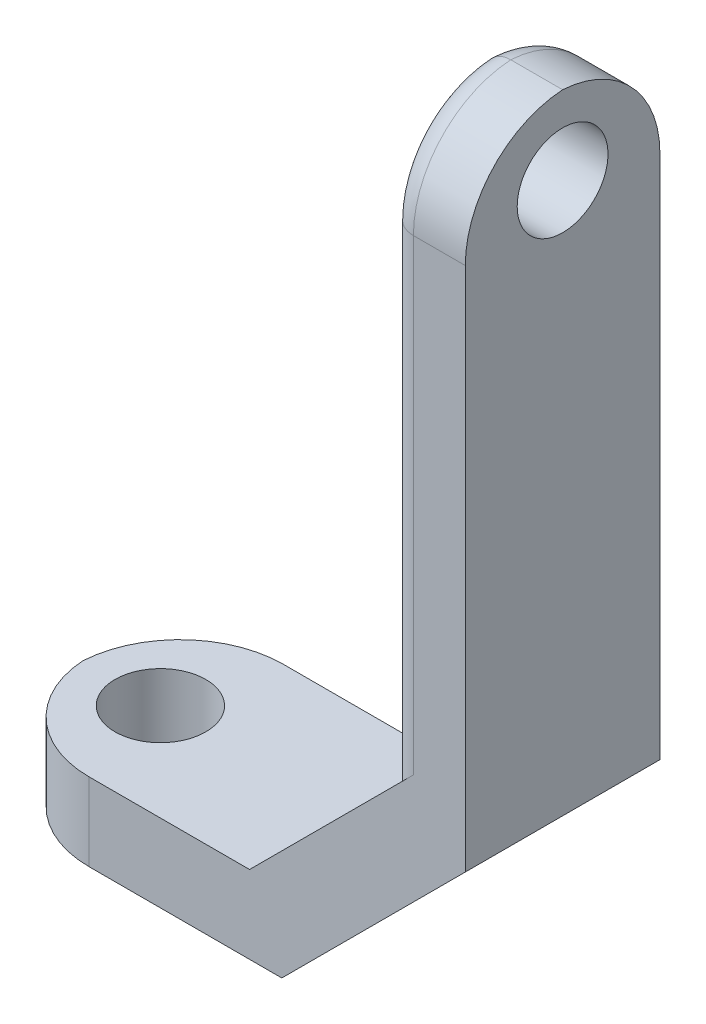
from build123d import *

# Parameters (mm, degrees)
EXTRUDE_1_DEPTH     = 15
SKETCH_3_R          = 3.5
CUT_EXTRUDE_1_DEPTH = 70.286826712
SKETCH_4_R          = 3.5
CUT_EXTRUDE_2_DEPTH = 67.277178243
FILLET_1_R          = 8
FILLET_4_R          = 2


with BuildPart() as part:
    # 草图1 → 凸台-拉伸1 (new body)
    with BuildSketch(Plane.XY):
        Polygon((0, 0), (0, -6), (22.857864376, -6), (37, 8.142135624), (37, 56.627416998), (31, 56.627416998), (31, 10.627416998), (20.372583002, 0), align=None)
    extrude(amount=EXTRUDE_1_DEPTH)

    # 草图3 → 切除-拉伸1 (cut, through all)
    with BuildSketch(Plane(origin=(0, 0, 0), x_dir=(1, 0, 0), z_dir=(0, 1, 0))):
        with Locations(Location((6, -7.5, 0), (0, 0, 180))):
            Circle(SKETCH_3_R)
    extrude(amount=-CUT_EXTRUDE_1_DEPTH, mode=Mode.SUBTRACT)

    # 草图4 → 切除-拉伸2 (cut, through all)
    with BuildSketch(Plane.ZY.offset(-31)):
        with Locations((7.5, 50.568542495)):
            Circle(SKETCH_4_R)
    extrude(amount=-CUT_EXTRUDE_2_DEPTH, mode=Mode.SUBTRACT)

    # 圆角1
    # the kernel refuses this fillet: 8 mm, written as the material it takes off along each edge
    with BuildSketch(Plane(origin=(0, 20, 15), x_dir=(0, 0, -1), z_dir=(0, -1, 0)), Plane(origin=(57, 56.627416998, 0), x_dir=(0, -1, 0), z_dir=(-1, 0, 0))) as fillet_1_piece_1:
        with BuildLine():
            CenterArc((FILLET_1_R, FILLET_1_R), FILLET_1_R, 180, 90)
            Line((0, FILLET_1_R), (0, 0))
            Line((0, 0), (FILLET_1_R, 0))
        make_face()
    extrude(amount=46, mode=Mode.SUBTRACT)
    with BuildSketch(Plane(origin=(0, 20, 0), x_dir=(0, 0, 1), z_dir=(0, -1, 0)), Plane(origin=(57, 56.627416998, 15), x_dir=(0, -1, 0), z_dir=(-1, 0, 0))) as fillet_1_piece_2:
        with BuildLine():
            CenterArc((FILLET_1_R, -FILLET_1_R), FILLET_1_R, 90, 90)
            Line((0, -FILLET_1_R), (0, 0))
            Line((0, 0), (FILLET_1_R, 0))
        make_face()
    extrude(amount=46, mode=Mode.SUBTRACT)

    # 圆角4
    # the kernel refuses this fillet: 2 mm, written as the material it takes off along each edge
    with BuildSketch(Plane(origin=(31, 48.627416998, 15), x_dir=(0, 0, -1), z_dir=(0, -1, 0))) as fillet_4_piece_1_section:
        with BuildLine():
            CenterArc((FILLET_4_R, FILLET_4_R), FILLET_4_R, 180, 90)
            Line((0, FILLET_4_R), (0, 0))
            Line((0, 0), (FILLET_4_R, 0))
        make_face()
    fillet_4_piece_1 = extrude(amount=43, mode=Mode.PRIVATE)
    fillet_4_piece_1 = split(fillet_4_piece_1, bisect_by=Plane(origin=(40.835879215, 20.463296213, 14.544284738), z_dir=(-0.7071067811865489, 0.7071067811865461, 0)), keep=Keep.TOP, mode=Mode.PRIVATE)
    add(fillet_4_piece_1, mode=Mode.SUBTRACT)
    with BuildSketch(Plane(origin=(31, 48.627416998, 0), x_dir=(1, 0, 0), z_dir=(0, -1, 0))) as fillet_4_piece_2_section:
        with BuildLine():
            CenterArc((FILLET_4_R, FILLET_4_R), FILLET_4_R, 180, 90)
            Line((0, FILLET_4_R), (0, 0))
            Line((0, 0), (FILLET_4_R, 0))
        make_face()
    fillet_4_piece_2 = extrude(amount=43, mode=Mode.PRIVATE)
    fillet_4_piece_2 = split(fillet_4_piece_2, bisect_by=Plane(origin=(40.835879215, 20.463296213, 0.455715262), z_dir=(-0.7071067811865489, 0.7071067811865461, 0)), keep=Keep.TOP, mode=Mode.PRIVATE)
    add(fillet_4_piece_2, mode=Mode.SUBTRACT)
    with BuildSketch(Plane(origin=(31, 48.627416998, 7), x_dir=(0, 0.8458227796369704, -0.5334639870199197), z_dir=(0, -0.5334639870199197, -0.8458227796369704))) as fillet_4_piece_3:
        with BuildLine():
            CenterArc((8 - FILLET_4_R, FILLET_4_R), FILLET_4_R, 270, 90)
            Line((8, FILLET_4_R), (8, 0))
            Line((8, 0), (8 - FILLET_4_R, 0))
        make_face()
    revolve(axis=Axis((31, 48.627416998, 7), (1, 0, 0)), revolution_arc=122.239802646, mode=Mode.SUBTRACT)
    with BuildSketch(Plane(origin=(31, 48.627416998, 8), x_dir=(0, 0, -1), z_dir=(0, -1, 0))) as fillet_4_piece_4:
        with BuildLine():
            CenterArc((8 - FILLET_4_R, FILLET_4_R), FILLET_4_R, 270, 90)
            Line((8, FILLET_4_R), (8, 0))
            Line((8, 0), (8 - FILLET_4_R, 0))
        make_face()
    revolve(axis=Axis((31, 48.627416998, 8), (1, 0, 0)), revolution_arc=122.239802646, mode=Mode.SUBTRACT)


solid = part.part
